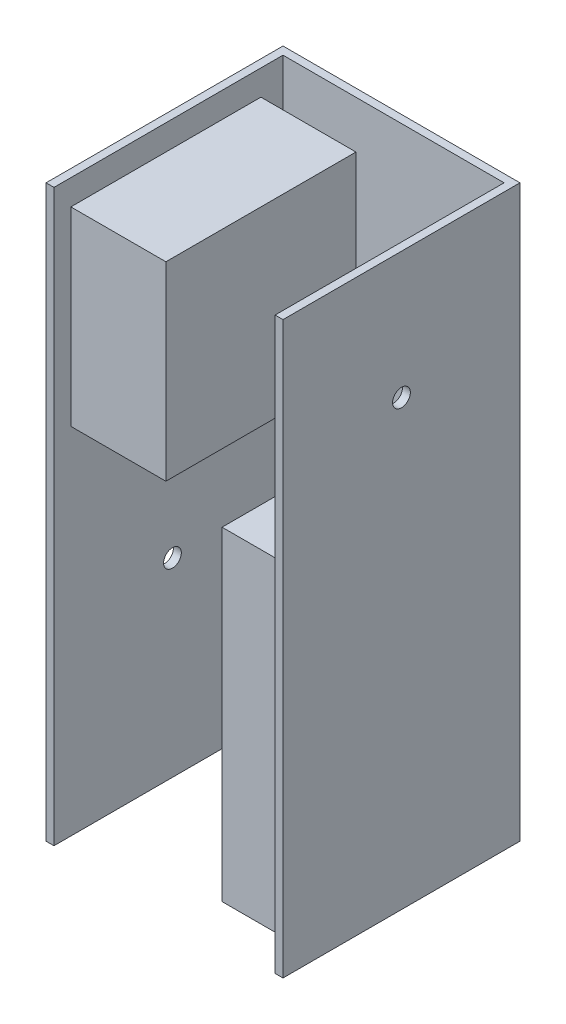
from build123d import *

# Parameters (mm, degrees)
BOSS_EXTRUDE1_DEPTH = 114.3
SKETCH3_W           = 30
SKETCH3_H           = 65
BOSS_EXTRUDE3_DEPTH = 12.7
SKETCH5_W           = 38.1
SKETCH5_H           = 38.1
BOSS_EXTRUDE4_DEPTH = 19.05
SKETCH8_R           = 1.778
CUT_EXTRUDE1_DEPTH  = 5.08
SKETCH9_R           = 1.778
CUT_EXTRUDE2_DEPTH  = 5.08
SKETCH10_R          = 1.778
CUT_EXTRUDE3_DEPTH  = 5.08
SKETCH13_R          = 1.778
CUT_EXTRUDE6_DEPTH  = 5.08


with BuildPart() as part:
    # Sketch1 → Boss-Extrude1 (new body)
    with BuildSketch(Plane(origin=(0, 0, 0), x_dir=(1, 0, 0), z_dir=(0, 1, 0))):
        Polygon((23.749, 23.749), (-23.749, 23.749), (-23.749, -23.749), (-22.1615, -23.749), (-22.1615, 22.1615), (22.1615, 22.1615), (22.1615, -23.749), (23.749, -23.749), align=None)
    extrude(amount=BOSS_EXTRUDE1_DEPTH)

    # Sketch3 → Boss-Extrude3 (add)
    with BuildSketch(Plane.ZY.offset(-22.1615)):
        with Locations((6.676756864, 37.58)):
            Rectangle(SKETCH3_W, SKETCH3_H)
    extrude(amount=BOSS_EXTRUDE3_DEPTH)

    # Sketch5 → Boss-Extrude4 (add)
    with BuildSketch(Plane(origin=(-22.1615, 0, 0), x_dir=(0, 0, -1), z_dir=(1, 0, 0))):
        with Locations((-1.315382142, 90.17)):
            Rectangle(SKETCH5_W, SKETCH5_H)
    extrude(amount=BOSS_EXTRUDE4_DEPTH)

    # Sketch8 → Cut-Extrude1 (cut)
    with BuildSketch(Plane(origin=(0, 0, -23.749), x_dir=(-1, 0, 0), z_dir=(0, 0, -1))):
        with Locations((0, 57.15)):
            Circle(SKETCH8_R)
    extrude(amount=-CUT_EXTRUDE1_DEPTH, mode=Mode.SUBTRACT)

    # Sketch9 → Cut-Extrude2 (cut)
    with BuildSketch(Plane.ZY.offset(23.749)):
        with Locations((0, 38.1)):
            Circle(SKETCH9_R)
    extrude(amount=-CUT_EXTRUDE2_DEPTH, mode=Mode.SUBTRACT)

    # Sketch10 → Cut-Extrude3 (cut)
    with BuildSketch(Plane(origin=(23.749, 0, 0), x_dir=(0, 0, -1), z_dir=(1, 0, 0))):
        with Locations((0, 88.9)):
            Circle(SKETCH10_R)
    extrude(amount=-CUT_EXTRUDE3_DEPTH, mode=Mode.SUBTRACT)

    # Sketch13 → Cut-Extrude6 (cut)
    with BuildSketch(Plane(origin=(0, 0, -23.749), x_dir=(-1, 0, 0), z_dir=(0, 0, -1))):
        with Locations((0, 25.4)):
            Circle(SKETCH13_R)
    extrude(amount=-CUT_EXTRUDE6_DEPTH, mode=Mode.SUBTRACT)


solid = part.part
